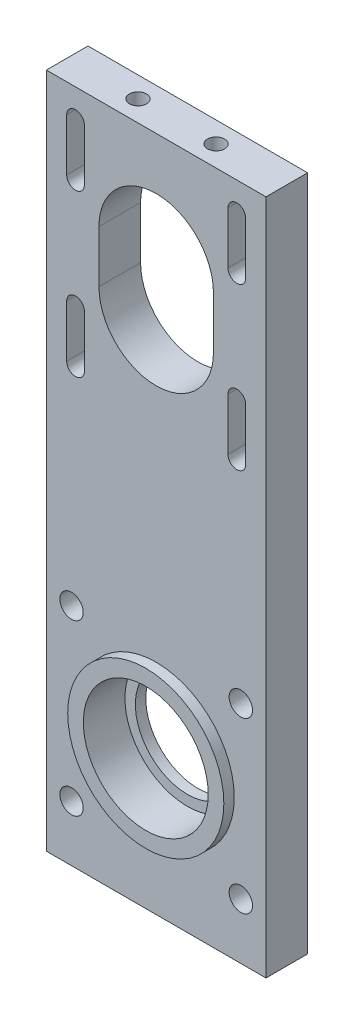
from build123d import *

# Parameters (mm, degrees)
SKETCH_1_W                   = 42.2
SKETCH_1_H                   = 60
EXTRUDE_1_DEPTH              = 4
SKETCH_5_R                   = 15
EXTRUDE_3_DEPTH              = 2
SKETCH_6_R                   = 10
CUT_EXTRUDE_3_DEPTH          = 39.015917719
SKETCH_7_R                   = 12
CUT_EXTRUDE_4_DEPTH          = 8
SKETCH_8_W                   = 42.2
SKETCH_8_H                   = 8
EXTRUDE_4_DEPTH              = 70
CUT_EXTRUDE_5_DEPTH          = 103.689872918
HOLE_START                   = -4
HOLE_WIZARD_M3_7_DEPTH       = 8
HOLE_WIZARD_M3_7_2_DEPTH     = 3
HOLE_WIZARD_M4_1_D           = 4.5
HOLE_WIZARD_M4_1_CBORE_D     = 8
HOLE_WIZARD_M4_1_CBORE_DEPTH = 4
M4X0_7_1_D                   = 3.3
M4X0_7_1_DEPTH               = 10.1
M4X0_7_1_TIP                 = 0.991420021
M4X0_7_2_D                   = 3.3
M4X0_7_2_DEPTH               = 8
M4X0_7_2_TIP                 = 0.991420021


# Read off the part's stored shape, not the designer's step: M3 凹頭蓋螺釘的柱孔7
with BuildPart() as part:
    # 草圖1 → 填料-伸長1 (new, symmetric)
    with BuildSketch(Plane.XY):
        Rectangle(SKETCH_1_W, SKETCH_1_H)
    extrude(amount=EXTRUDE_1_DEPTH, both=True)

    # 草圖5 → 填料-伸長3 (add)
    with BuildSketch(Plane.XY.offset(4)):
        with Locations((0, -3)):
            Circle(SKETCH_5_R)
    extrude(amount=EXTRUDE_3_DEPTH)

    # 草圖6 → 除料-伸長3 (cut, through all)
    with BuildSketch(Plane.XY.offset(6)):
        with Locations((0, -3)):
            Circle(SKETCH_6_R)
    extrude(amount=-CUT_EXTRUDE_3_DEPTH, mode=Mode.SUBTRACT)

    # 草圖7 → 除料-伸長4 (cut)
    with BuildSketch(Plane.XY.offset(6)):
        with Locations((0, -3)):
            Circle(SKETCH_7_R)
    extrude(amount=-CUT_EXTRUDE_4_DEPTH, mode=Mode.SUBTRACT)

    # 草圖8 → 填料-伸長4 (add)
    with BuildSketch(Plane(origin=(0, 30, 0), x_dir=(1, 0, 0), z_dir=(0, 1, 0))):
        Rectangle(SKETCH_8_W, SKETCH_8_H)
    extrude(amount=EXTRUDE_4_DEPTH)

    # 草圖9 → 除料-伸長5 (cut, through all)
    with BuildSketch(Plane(origin=(0, 0, -4), x_dir=(-1, 0, 0), z_dir=(0, 0, -1))):
        with BuildLine():
            Line((11, 79), (11, 69))
            ThreePointArc((11, 69), (0, 58), (-11, 69))
            Line((-11, 69), (-11, 79))
            ThreePointArc((-11, 79), (0, 90), (11, 79))
        make_face()
    extrude(amount=-CUT_EXTRUDE_5_DEPTH, mode=Mode.SUBTRACT)

    # M3 凹頭蓋螺釘的柱孔7 outline → M3 凹頭蓋螺釘的柱孔7 (cut)
    with BuildSketch(Plane.XY.offset(HOLE_START)):
        with BuildLine():
            Line((-13.8, 53.5), (-13.8, 63.5))
            ThreePointArc((-13.8, 63.5), (-15.5, 65.2), (-17.2, 63.5))
            Line((-17.2, 63.5), (-17.2, 53.5))
            ThreePointArc((-17.2, 53.5), (-15.5, 51.8), (-13.8, 53.5))
        make_face()
        with BuildLine():
            Line((-13.8, 84.5), (-13.8, 94.5))
            ThreePointArc((-13.8, 94.5), (-15.5, 96.2), (-17.2, 94.5))
            Line((-17.2, 94.5), (-17.2, 84.5))
            ThreePointArc((-17.2, 84.5), (-15.5, 82.8), (-13.8, 84.5))
        make_face()
        with BuildLine():
            ThreePointArc((17.2, 63.5), (15.5, 65.2), (13.8, 63.5))
            Line((13.8, 63.5), (13.8, 53.5))
            ThreePointArc((13.8, 53.5), (15.5, 51.8), (17.2, 53.5))
            Line((17.2, 53.5), (17.2, 63.5))
        make_face()
        with BuildLine():
            ThreePointArc((17.2, 94.5), (15.5, 96.2), (13.8, 94.5))
            Line((13.8, 94.5), (13.8, 84.5))
            ThreePointArc((13.8, 84.5), (15.5, 82.8), (17.2, 84.5))
            Line((17.2, 84.5), (17.2, 94.5))
        make_face()
    extrude(amount=HOLE_WIZARD_M3_7_DEPTH, mode=Mode.SUBTRACT)

    # Hole Wizard M3 _7 2 outline → Hole Wizard M3 _7 2 (cut)
    # profile 1 of 4: a face of its own
    with BuildSketch(Plane.XY.offset(HOLE_START)):
        with BuildLine():
            ThreePointArc((-12.25, 63.5), (-15.5, 66.75), (-18.75, 63.5))
            Line((-18.75, 63.5), (-18.75, 53.5))
            ThreePointArc((-18.75, 53.5), (-15.5, 50.25), (-12.25, 53.5))
            Line((-12.25, 53.5), (-12.25, 63.5))
        make_face()
        with BuildLine():
            ThreePointArc((-17.2, 63.5), (-15.5, 65.2), (-13.8, 63.5))
            Line((-13.8, 63.5), (-13.8, 53.5))
            ThreePointArc((-13.8, 53.5), (-15.5, 51.8), (-17.2, 53.5))
            Line((-17.2, 53.5), (-17.2, 63.5))
        make_face(mode=Mode.SUBTRACT)
    # profile 2 of 4: a face of its own
    with BuildSketch(Plane.XY.offset(HOLE_START)):
        with BuildLine():
            Line((-12.25, 84.5), (-12.25, 94.5))
            ThreePointArc((-12.25, 94.5), (-15.5, 97.75), (-18.75, 94.5))
            Line((-18.75, 94.5), (-18.75, 84.5))
            ThreePointArc((-18.75, 84.5), (-15.5, 81.25), (-12.25, 84.5))
        make_face()
        with BuildLine():
            ThreePointArc((-17.2, 94.5), (-15.5, 96.2), (-13.8, 94.5))
            Line((-13.8, 94.5), (-13.8, 84.5))
            ThreePointArc((-13.8, 84.5), (-15.5, 82.8), (-17.2, 84.5))
            Line((-17.2, 84.5), (-17.2, 94.5))
        make_face(mode=Mode.SUBTRACT)
    # profile 3 of 4: a face of its own
    with BuildSketch(Plane.XY.offset(HOLE_START)):
        with BuildLine():
            ThreePointArc((18.75, 63.5), (15.5, 66.75), (12.25, 63.5))
            Line((12.25, 63.5), (12.25, 53.5))
            ThreePointArc((12.25, 53.5), (15.5, 50.25), (18.75, 53.5))
            Line((18.75, 53.5), (18.75, 63.5))
        make_face()
        with BuildLine():
            Line((13.8, 53.5), (13.8, 63.5))
            ThreePointArc((13.8, 63.5), (15.5, 65.2), (17.2, 63.5))
            Line((17.2, 63.5), (17.2, 53.5))
            ThreePointArc((17.2, 53.5), (15.5, 51.8), (13.8, 53.5))
        make_face(mode=Mode.SUBTRACT)
    # profile 4 of 4: a face of its own
    with BuildSketch(Plane.XY.offset(HOLE_START)):
        with BuildLine():
            Line((18.75, 84.5), (18.75, 94.5))
            ThreePointArc((18.75, 94.5), (15.5, 97.75), (12.25, 94.5))
            Line((12.25, 94.5), (12.25, 84.5))
            ThreePointArc((12.25, 84.5), (15.5, 81.25), (18.75, 84.5))
        make_face()
        with BuildLine():
            Line((13.8, 84.5), (13.8, 94.5))
            ThreePointArc((13.8, 94.5), (15.5, 96.2), (17.2, 94.5))
            Line((17.2, 94.5), (17.2, 84.5))
            ThreePointArc((17.2, 84.5), (15.5, 82.8), (13.8, 84.5))
        make_face(mode=Mode.SUBTRACT)
    extrude(amount=HOLE_WIZARD_M3_7_2_DEPTH, mode=Mode.SUBTRACT)

    # M4 凹頭蓋螺釘的柱孔1 (through all)
    with Locations(Plane(origin=(0, 0, -4), x_dir=(-1, 0, 0), z_dir=(0, 0, -1))):
        with Locations((16.263455967, 13.263455967), (-16.263455967, -19.263455967), (-16.263455967, 13.263455967), (16.263455967, -19.263455967)):
            CounterBoreHole(HOLE_WIZARD_M4_1_D / 2, HOLE_WIZARD_M4_1_CBORE_D / 2, HOLE_WIZARD_M4_1_CBORE_DEPTH)

    # M4x0.7 螺紋孔1
    with Locations(Plane(origin=(0, -30, 0), x_dir=(-1, 0, 0), z_dir=(0, -1, 0))):
        with Locations((10, 0), (-10, 0)):
            Hole(M4X0_7_1_D / 2, depth=M4X0_7_1_DEPTH)
            with Locations((0, 0, -(M4X0_7_1_DEPTH + M4X0_7_1_TIP / 2))):  # 118° drill point
                Cone(0, M4X0_7_1_D / 2, M4X0_7_1_TIP, mode=Mode.SUBTRACT)

    # M4x0.7 螺紋孔2
    with Locations(Plane(origin=(0, 100, 0), x_dir=(1, 0, 0), z_dir=(0, 1, 0))):
        with Locations((-7.5, 0), (7.5, 0)):
            Hole(M4X0_7_2_D / 2, depth=M4X0_7_2_DEPTH)
            with Locations((0, 0, -(M4X0_7_2_DEPTH + M4X0_7_2_TIP / 2))):  # 118° drill point
                Cone(0, M4X0_7_2_D / 2, M4X0_7_2_TIP, mode=Mode.SUBTRACT)


solid = part.part
